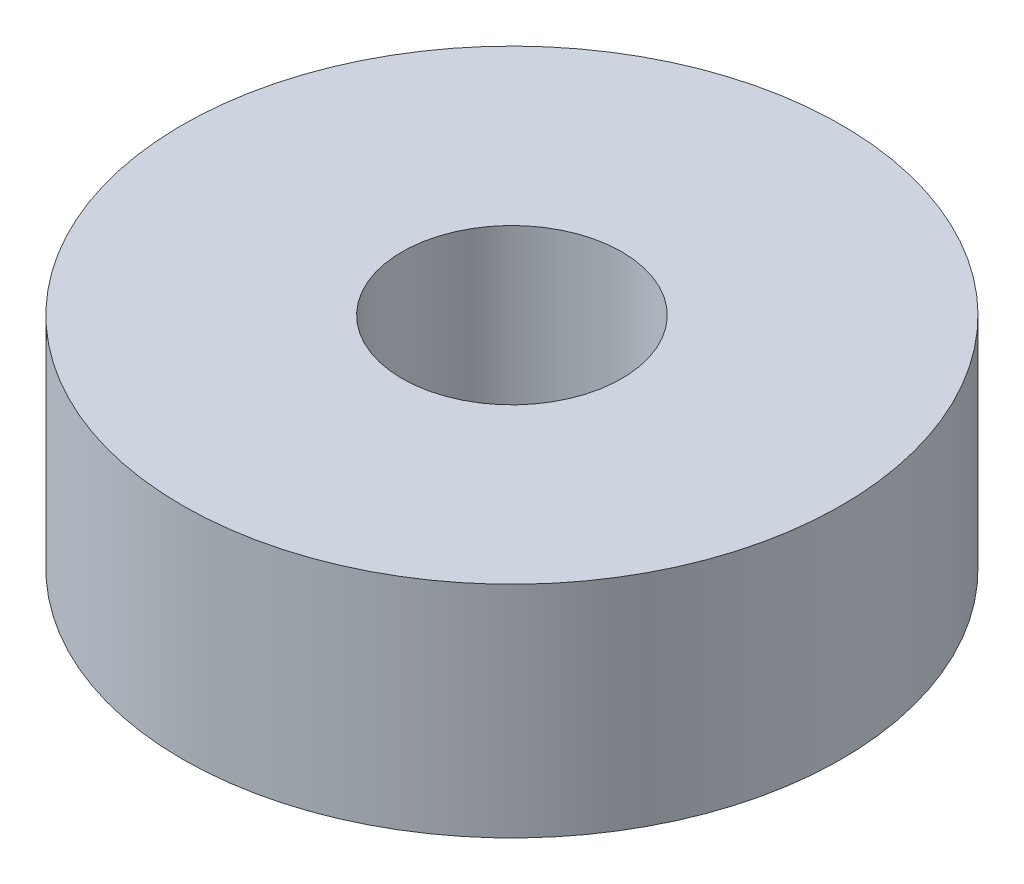
from build123d import *

# Parameters (mm, degrees)
SKETCH1_R           = 4.7625
SKETCH1_R_2         = 1.5875
BOSS_EXTRUDE1_DEPTH = 3.175


with BuildPart() as part:
    # Sketch1 → Boss-Extrude1 (new body)
    with BuildSketch(Plane(origin=(0, 0, 0), x_dir=(1, 0, 0), z_dir=(0, 1, 0))):
        Circle(SKETCH1_R)
        Circle(SKETCH1_R_2, mode=Mode.SUBTRACT)
    extrude(amount=BOSS_EXTRUDE1_DEPTH)


solid = part.part
